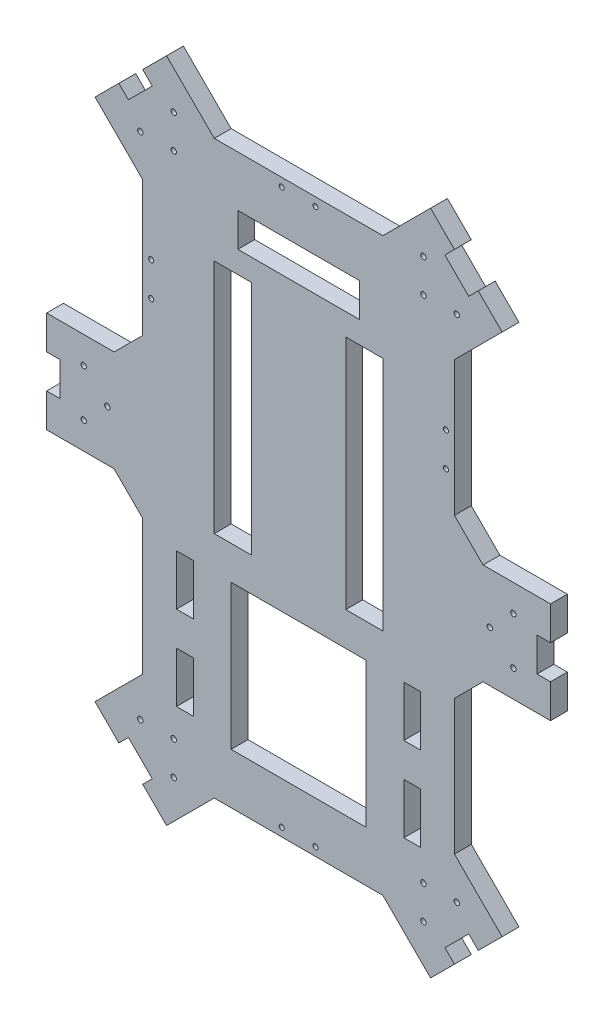
from build123d import *

# Parameters (mm, degrees)
DODANIE_WYCI_GNI_CIE1_DEPTH     = 5
WYTNIJ_WYCI_GNI_CIE7_DEPTH      = 42
WYTNIJ_WYCI_GNI_CIE7_DEPTH_BACK = 60
SZKIC11_R                       = 0.8
WYTNIJ_WYCI_GNI_CIE8_DEPTH      = 36
WYTNIJ_WYCI_GNI_CIE8_DEPTH_BACK = 66
SZKIC12_R                       = 0.75
WYTNIJ_WYCI_GNI_CIE9_DEPTH      = 54
WYTNIJ_WYCI_GNI_CIE9_DEPTH_BACK = 47
SZKIC13_W                       = 11
SZKIC13_H                       = 70
SZKIC13_W_2                     = 40
SZKIC13_H_2                     = 42.9
SZKIC13_W_3                     = 5
SZKIC13_H_3                     = 15
SZKIC13_W_4                     = 36
SZKIC13_H_4                     = 10


with BuildPart() as part:
    # Szkic1 → Dodanie-wyciągnięcie1 (new body)
    with BuildSketch(Plane.XY):
        Polygon((0, 0), (-50, 0), (-64.142135624, 14.142135624), (-71.213203436, 7.071067812), (-68.384776311, 4.242640687), (-75.455844123, -2.828427125), (-78.284271247, 0), (-85.355339059, -7.071067812), (-71.213203436, -21.213203436), (-71.213203436, -61.213203436), (-79.69848481, -69.69848481), (-99.69848481, -69.69848481), (-99.69848481, -79.69848481), (-95.69848481, -79.69848481), (-95.69848481, -89.69848481), (-99.69848481, -89.69848481), (-99.69848481, -99.69848481), (-79.69848481, -99.69848481), (-71.213203436, -108.183766184), (-71.213203436, -148.183766184), (-85.355339059, -162.325901808), (-78.284271247, -169.39696962), (-75.455844123, -166.568542495), (-68.384776311, -173.639610307), (-71.213203436, -176.468037432), (-64.142135624, -183.539105243), (-50, -169.39696962), (0, -169.39696962), (14.142135624, -183.539105243), (21.213203436, -176.468037432), (18.384776311, -173.639610307), (25.455844123, -166.568542495), (28.284271247, -169.39696962), (35.355339059, -162.325901808), (21.213203436, -148.183766184), (21.213203436, -108.183766184), (29.69848481, -99.69848481), (49.69848481, -99.69848481), (49.69848481, -89.69848481), (45.69848481, -89.69848481), (45.69848481, -79.69848481), (49.69848481, -79.69848481), (49.69848481, -69.69848481), (29.69848481, -69.69848481), (21.213203436, -61.213203436), (21.213203436, -21.213203436), (35.355339059, -7.071067812), (28.284271247, 0), (25.455844123, -2.828427125), (18.384776311, 4.242640687), (21.213203436, 7.071067812), (14.142135624, 14.142135624), align=None)
    extrude(amount=DODANIE_WYCI_GNI_CIE1_DEPTH)

    # Szkic11 → Wytnij-wyciągnięcie7 (cut, two sides: drawn at the far end of the back side and taken through both)
    with BuildSketch(Plane.XY.offset(5).offset(-WYTNIJ_WYCI_GNI_CIE7_DEPTH_BACK)):
        with Locations((-81.69848481, -84.69848481)):
            Circle(SZKIC11_R)
        with Locations((-88.69848481, -77.69848481)):
            Circle(SZKIC11_R)
        with Locations((-88.69848481, -91.69848481)):
            Circle(SZKIC11_R)
        with Locations((-62.02081528, -9.192388155)):
            Circle(SZKIC11_R)
        with Locations((-62.02081528, 0.707106781)):
            Circle(SZKIC11_R)
        with Locations((-71.920310217, -9.192388155)):
            Circle(SZKIC11_R)
        with Locations((12.02081528, -9.192388155)):
            Circle(SZKIC11_R)
        with Locations((12.02081528, 0.707106781)):
            Circle(SZKIC11_R)
        with Locations((21.920310217, -9.192388155)):
            Circle(SZKIC11_R)
        with Locations((31.69848481, -84.69848481)):
            Circle(SZKIC11_R)
        with Locations((38.69848481, -77.69848481)):
            Circle(SZKIC11_R)
        with Locations((38.69848481, -91.69848481)):
            Circle(SZKIC11_R)
        with Locations((12.02081528, -160.204581464)):
            Circle(SZKIC11_R)
        with Locations((21.920310217, -160.204581464)):
            Circle(SZKIC11_R)
        with Locations((12.02081528, -170.104076401)):
            Circle(SZKIC11_R)
        with Locations((-62.02081528, -160.204581464)):
            Circle(SZKIC11_R)
        with Locations((-71.920310217, -160.204581464)):
            Circle(SZKIC11_R)
        with Locations((-62.02081528, -170.104076401)):
            Circle(SZKIC11_R)
    extrude(amount=WYTNIJ_WYCI_GNI_CIE7_DEPTH + WYTNIJ_WYCI_GNI_CIE7_DEPTH_BACK, mode=Mode.SUBTRACT)

    # Szkic12 → Wytnij-wyciągnięcie8 (cut, two sides: drawn at the far end of the back side and taken through both)
    with BuildSketch(Plane.XY.offset(5).offset(-WYTNIJ_WYCI_GNI_CIE8_DEPTH_BACK)):
        with Locations((-30, -2.5)):
            Circle(SZKIC12_R)
        with Locations((-20, -2.5)):
            Circle(SZKIC12_R)
        with Locations((-30, -166.89696962)):
            Circle(SZKIC12_R)
        with Locations((-20, -166.89696962)):
            Circle(SZKIC12_R)
        with Locations((-68.713203436, -40.5)):
            Circle(SZKIC12_R)
        with Locations((-68.713203436, -50.5)):
            Circle(SZKIC12_R)
        with Locations((18.713203436, -40.5)):
            Circle(SZKIC12_R)
        with Locations((18.713203436, -50.5)):
            Circle(SZKIC12_R)
    extrude(amount=WYTNIJ_WYCI_GNI_CIE8_DEPTH + WYTNIJ_WYCI_GNI_CIE8_DEPTH_BACK, mode=Mode.SUBTRACT)

    # Szkic13 → Wytnij-wyciągnięcie9 (cut, two sides: drawn at the far end of the back side and taken through both)
    with BuildSketch(Plane.XY.offset(-WYTNIJ_WYCI_GNI_CIE9_DEPTH_BACK)):
        with Locations((-44.503203436, -66.5)):
            Rectangle(SZKIC13_W, SZKIC13_H)
        with Locations((-5.496796564, -66.5)):
            Rectangle(SZKIC13_W, SZKIC13_H)
        with Locations((-25.003203436, -132.94696962)):
            Rectangle(SZKIC13_W_2, SZKIC13_H_2)
        with Locations((-58.713203436, -118.99696962)):
            Rectangle(SZKIC13_W_3, SZKIC13_H_3)
        with Locations((-58.713203436, -143.99696962)):
            Rectangle(SZKIC13_W_3, SZKIC13_H_3)
        with Locations((8.713203436, -119)):
            Rectangle(SZKIC13_W_3, SZKIC13_H_3)
        with Locations((8.713203436, -144)):
            Rectangle(SZKIC13_W_3, SZKIC13_H_3)
        with Locations((-25.003203436, -20)):
            Rectangle(SZKIC13_W_4, SZKIC13_H_4)
    extrude(amount=WYTNIJ_WYCI_GNI_CIE9_DEPTH + WYTNIJ_WYCI_GNI_CIE9_DEPTH_BACK, mode=Mode.SUBTRACT)


solid = part.part
